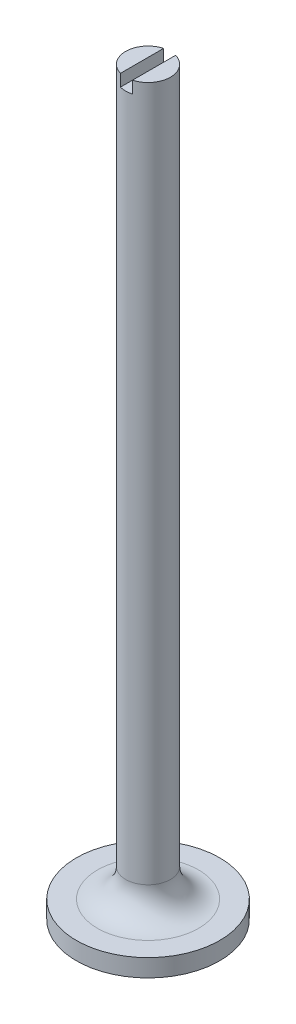
from build123d import *

# Parameters (mm, degrees)
FILLET1_R               = 4
CUT_EXTRUDE3_DEPTH      = 106.978541224
CUT_EXTRUDE3_DEPTH_BACK = 106.978541224
SKETCH4_W               = 1.7
SKETCH4_H               = 1.7


with BuildPart() as part:
    # Sketch1 → Revolve1 (revolve)
    with BuildSketch(Plane.XY):
        Polygon((0, 0), (10.16, 0), (10.16, 2.5), (3.175, 2.5), (3.175, 105), (0, 105), align=None)
    revolve(axis=Axis((0, -31.831703756, 0), (0, 1, 0)))

    # Fillet1
    fillet1_edges = [part.edges().sort_by_distance(p)[0] for p in [
        (-3.175, 2.5, 0),
    ]]
    fillet(fillet1_edges, radius=FILLET1_R)

    # Sketch4 → Cut-Extrude3 (cut, two sides: drawn at the far end of the back side and taken through both)
    with BuildSketch(Plane.XY.offset(-CUT_EXTRUDE3_DEPTH_BACK)):
        with Locations((0, 104.15)):
            Rectangle(SKETCH4_W, SKETCH4_H)
    extrude(amount=CUT_EXTRUDE3_DEPTH + CUT_EXTRUDE3_DEPTH_BACK, mode=Mode.SUBTRACT)


solid = part.part
